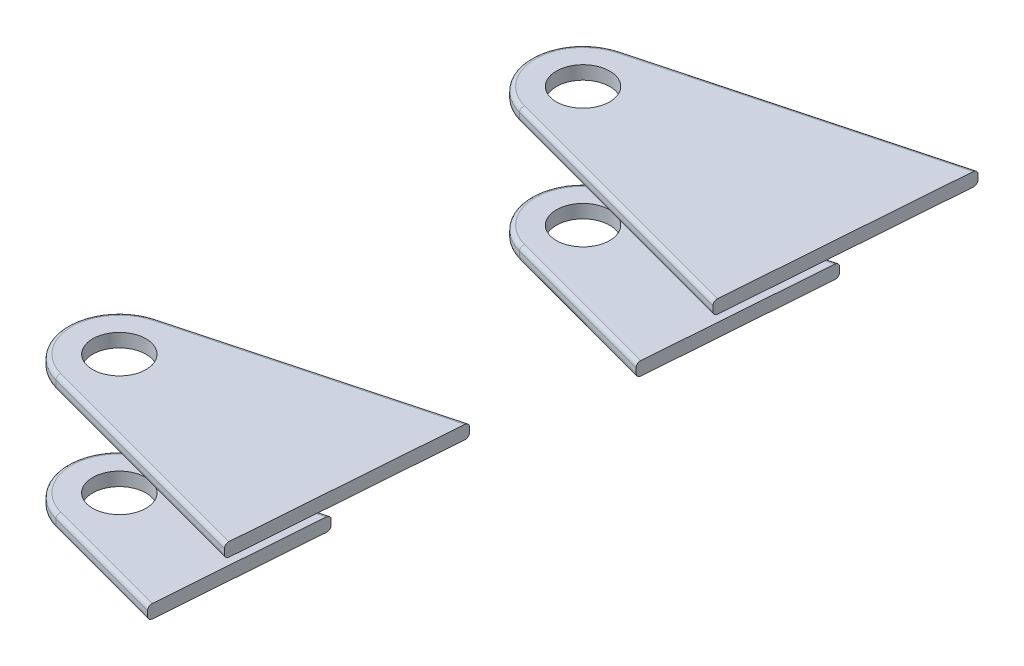
from build123d import *

# Parameters (mm, degrees)
SKETCH11_R                        = 12.7
SKETCH11_R_2                      = 10.7
STRUCTURAL_MEMBER1_DEPTH          = 323.944708568
SKETCH11_ON_SEGMENT_2_R           = 12.7
SKETCH11_ON_SEGMENT_2_R_2         = 10.7
STRUCTURAL_MEMBER1_2_DEPTH        = 323.944708568
EXTRUDEBEARINGRETAINERCYL_START   = -8.5
SKETCH13_R                        = 20.1
SKETCH13_R_2                      = 18.5
EXTRUDEBEARINGRETAINERCYL_DEPTH   = 17
EXTRUDEBRACKETBOTTOM_DEPTH        = 1
EXTRUDEBRACKETTOP_DEPTH           = 1
EXTRUDEBRACKETTOP_2_DEPTH         = 1
EXTRUDEBRACKETTOP_3_DEPTH         = 1
EXTRUDEPILLOWBLOCKTOCYL_START     = -72.5
EXTRUDEPILLOWBLOCKTOCYL_DEPTH     = 1.6
EXTRUDEPILLOWBLOCKTOCYL_START_2   = -59.1
EXTRUDEPILLOWBLOCKTOCYL_2_DEPTH   = 1.6
EXTRUDEPILLOWBLOCKTOCYL_START_3   = 57.5
EXTRUDEPILLOWBLOCKTOCYL_3_DEPTH   = 1.6
EXTRUDEPILLOWBLOCKTOCYL_START_4   = 70.9
EXTRUDEPILLOWBLOCKTOCYL_4_DEPTH   = 1.6
SKETCH28_W                        = 75.967346768
SKETCH28_H                        = 30.904
EXTRUDETRIMPILLOWBLOCKS_DEPTH     = 145
SKETCH29_R                        = 6
EXTRUDEPILLOWBLOCKBOSSES_DEPTH    = 30.904
FILLET6_START                     = 1
FILLET6_DEPTH                     = 29.904
FILLET6_2_DEPTH                   = 30.904
FILLET6_3_ANGLE                   = 105.281339
FILLET6_4_ANGLE                   = 105.281339
FILLET6_5_ANGLE                   = 105.281339
EXTRUDEPILLOWBLOCKTOPS_REACH      = 277.503
EXTRUDEPILLOWBLOCKTOPS_END_RADIUS = 20.1
SKETCH30_W                        = 15
SKETCH30_H                        = 3
FILLETPILLOWBLOCKTOPS_R           = 3
SKETCH19_R                        = 3.175
EXTRUDEBEARINGRETAINERHOLES_DEPTH = 380.637720529
EXTRUDEBRACKETFRONT_DEPTH         = 1.6
EXTRUDEBRACKETREAR_START          = -70
EXTRUDEBRACKETREAR_DEPTH          = 1.6
SKETCH25_R                        = 6.175
EXTRUDEMOUNTINGBOSSES_DEPTH       = 11.7
EXTRUDE2_DEPTH                    = 380.993173687
EXTRUDE2_DEPTH_BACK               = 380.993173687
SKETCH26_R                        = 3.175
SKETCH36_R                        = 3.175
EXTRUDE7_DEPTH                    = 1.6
EXTRUDE7_2_DEPTH                  = 1.6
SKETCH38_R                        = 3.175
EXTRUDE10_DEPTH                   = 1.6
EXTRUDE10_2_DEPTH                 = 1.6
FILLET25_R                        = 0.5
FILLET26_R                        = 0.5
FILLET27_R                        = 0.5
FILLET28_R                        = 0.5


with BuildPart() as part:
    # Sketch11 → Structural Member1 (new body)
    with BuildSketch(Plane(origin=(-155.9, 0, 323.047), x_dir=(-0.9972288216354868, 0, 0.07439541181752263), z_dir=(-0.07439541181752263, 0, -0.9972288216354868))):
        Circle(SKETCH11_R)
        Circle(SKETCH11_R_2, mode=Mode.SUBTRACT)
    extrude(amount=STRUCTURAL_MEMBER1_DEPTH)


with BuildPart() as body_2:
    # Sketch11 on segment 2 (carried to segment 2) → Structural Member1 2 (new body)
    with BuildSketch(Plane(origin=(180, 0, 0), x_dir=(0.997228822, 0, 0.074395412), z_dir=(-0.074395412, 0, 0.997228822))):
        Circle(SKETCH11_ON_SEGMENT_2_R)
        Circle(SKETCH11_ON_SEGMENT_2_R_2, mode=Mode.SUBTRACT)
    extrude(amount=STRUCTURAL_MEMBER1_2_DEPTH)


with BuildPart() as body_3:
    # Sketch13 → ExtrudeBearingRetainerCyl (new body)
    with BuildSketch(Plane(origin=(65, 0, 0), x_dir=(0, 0, -1), z_dir=(1, 0, 0)).offset(EXTRUDEBEARINGRETAINERCYL_START)):
        with Locations((-98, 27.904)):
            Circle(SKETCH13_R)
        with Locations((-98, 27.904)):
            Circle(SKETCH13_R_2, mode=Mode.SUBTRACT)
    extrude(amount=EXTRUDEBEARINGRETAINERCYL_DEPTH)


with BuildPart() as body_4:
    # MirrorBearingRetainerCyl: mirrored copy
    add(body_3.part.mirror(Plane(origin=(0, 0, 0), x_dir=(0, 0, 1), z_dir=(1, 0, 0))))



with BuildPart() as body_5:
    # Sketch15 → ExtrudeBracketBottom (new body)
    with BuildSketch(Plane(origin=(0, 0, 0), x_dir=(1, 0, 0), z_dir=(0, 1, 0))):
        with BuildLine():
            Line((-150, -63), (115, -63))
            ThreePointArc((115, -63), (122.071067812, -60.071067812), (125, -53))
            Line((125, -53), (125, -48))
            ThreePointArc((125, -48), (137.5, -35.5), (150, -48))
            Line((150, -48), (150, -63))
            Line((150, -63), (150, -133))
            Line((150, -133), (-150, -133))
            Line((-150, -133), (-150, -63))
        make_face()
        with BuildLine():
            Line((-130, -75), (130, -75))
            ThreePointArc((130, -75), (137.071067812, -77.928932188), (140, -85))
            Line((140, -85), (140, -111))
            ThreePointArc((140, -111), (137.071067812, -118.071067812), (130, -121))
            Line((130, -121), (-130, -121))
            ThreePointArc((-130, -121), (-137.071067812, -118.071067812), (-140, -111))
            Line((-140, -111), (-140, -85))
            ThreePointArc((-140, -85), (-137.071067812, -77.928932188), (-130, -75))
        make_face(mode=Mode.SUBTRACT)
    extrude(amount=EXTRUDEBRACKETBOTTOM_DEPTH)


with BuildPart() as body_6:
    # Sketch17 → ExtrudeBracketTop (new body)
    with BuildSketch(Plane(origin=(0, 12.7, 0), x_dir=(-1, 0, 0), z_dir=(0, 1, 0))):
        with BuildLine():
            Line((150, 63), (72.5, 63))
            Line((72.5, 63), (72.5, 82))
            Line((72.5, 82), (77.5, 82))
            ThreePointArc((77.5, 82), (80.328427125, 83.171572875), (81.5, 86))
            Line((81.5, 86), (81.5, 110))
            ThreePointArc((81.5, 110), (80.328427125, 112.828427125), (77.5, 114))
            Line((77.5, 114), (72.5, 114))
            Line((72.5, 114), (72.5, 133))
            Line((72.5, 133), (150, 133))
            Line((150, 133), (150, 63))
        make_face()
        with BuildLine():
            Line((104.221825407, 94.464466094), (97.535533906, 87.778174593))
            ThreePointArc((97.535533906, 87.778174593), (92.086582838, 86.694310836), (89, 91.313708499))
            Line((89, 91.313708499), (89, 104.686291501))
            ThreePointArc((89, 104.686291501), (92.086582838, 109.305689164), (97.535533906, 108.221825407))
            Line((97.535533906, 108.221825407), (104.221825407, 101.535533906))
            ThreePointArc((104.221825407, 101.535533906), (105.686291501, 98), (104.221825407, 94.464466094))
        make_face(mode=Mode.SUBTRACT)
        with BuildLine():
            Line((118.686291501, 121), (105.313708499, 121))
            ThreePointArc((105.313708499, 121), (100.694310836, 117.913417162), (101.778174593, 112.464466094))
            Line((101.778174593, 112.464466094), (108.464466094, 105.778174593))
            ThreePointArc((108.464466094, 105.778174593), (112, 104.313708499), (115.535533906, 105.778174593))
            Line((115.535533906, 105.778174593), (122.221825407, 112.464466094))
            ThreePointArc((122.221825407, 112.464466094), (123.305689164, 117.913417162), (118.686291501, 121))
        make_face(mode=Mode.SUBTRACT)
        with BuildLine():
            Line((108.464466094, 90.221825407), (101.778174593, 83.535533906))
            ThreePointArc((101.778174593, 83.535533906), (100.694310836, 78.086582838), (105.313708499, 75))
            Line((105.313708499, 75), (118.686291501, 75))
            ThreePointArc((118.686291501, 75), (123.305689164, 78.086582838), (122.221825407, 83.535533906))
            Line((122.221825407, 83.535533906), (115.535533906, 90.221825407))
            ThreePointArc((115.535533906, 90.221825407), (112, 91.686291501), (108.464466094, 90.221825407))
        make_face(mode=Mode.SUBTRACT)
        with BuildLine():
            Line((126.464466094, 108.221825407), (119.778174593, 101.535533906))
            ThreePointArc((119.778174593, 101.535533906), (118.313708499, 98), (119.778174593, 94.464466094))
            Line((119.778174593, 94.464466094), (126.464466094, 87.778174593))
            ThreePointArc((126.464466094, 87.778174593), (131.913417162, 86.694310836), (135, 91.313708499))
            Line((135, 91.313708499), (135, 104.686291501))
            ThreePointArc((135, 104.686291501), (131.913417162, 109.305689164), (126.464466094, 108.221825407))
        make_face(mode=Mode.SUBTRACT)
    extrude(amount=-EXTRUDEBRACKETTOP_DEPTH)


with BuildPart() as body_7:
    # Sketch17 → ExtrudeBracketTop 2 (new body)
    with BuildSketch(Plane(origin=(0, 12.7, 0), x_dir=(-1, 0, 0), z_dir=(0, 1, 0))):
        with BuildLine():
            Line((-150, 133), (-72.5, 133))
            Line((-72.5, 133), (-72.5, 114))
            Line((-72.5, 114), (-77.5, 114))
            ThreePointArc((-77.5, 114), (-80.328427125, 112.828427125), (-81.5, 110))
            Line((-81.5, 110), (-81.5, 86))
            ThreePointArc((-81.5, 86), (-80.328427125, 83.171572875), (-77.5, 82))
            Line((-77.5, 82), (-72.5, 82))
            Line((-72.5, 82), (-72.5, 63))
            Line((-72.5, 63), (-115, 63))
            ThreePointArc((-115, 63), (-122.071067812, 60.071067812), (-125, 53))
            Line((-125, 53), (-125, 48))
            ThreePointArc((-125, 48), (-137.5, 35.5), (-150, 48))
            Line((-150, 48), (-150, 51.104))
            Line((-150, 51.104), (-150, 133))
        make_face()
        with BuildLine():
            Line((-119.778174593, 94.464466094), (-126.464466094, 87.778174593))
            ThreePointArc((-126.464466094, 87.778174593), (-131.913417162, 86.694310836), (-135, 91.313708499))
            Line((-135, 91.313708499), (-135, 104.686291501))
            ThreePointArc((-135, 104.686291501), (-131.913417162, 109.305689164), (-126.464466094, 108.221825407))
            Line((-126.464466094, 108.221825407), (-119.778174593, 101.535533906))
            ThreePointArc((-119.778174593, 101.535533906), (-118.313708499, 98), (-119.778174593, 94.464466094))
        make_face(mode=Mode.SUBTRACT)
        with BuildLine():
            Line((-105.313708499, 75), (-118.686291501, 75))
            ThreePointArc((-118.686291501, 75), (-123.305689164, 78.086582838), (-122.221825407, 83.535533906))
            Line((-122.221825407, 83.535533906), (-115.535533906, 90.221825407))
            ThreePointArc((-115.535533906, 90.221825407), (-112, 91.686291501), (-108.464466094, 90.221825407))
            Line((-108.464466094, 90.221825407), (-101.778174593, 83.535533906))
            ThreePointArc((-101.778174593, 83.535533906), (-100.694310836, 78.086582838), (-105.313708499, 75))
        make_face(mode=Mode.SUBTRACT)
        with BuildLine():
            Line((-101.778174593, 112.464466094), (-108.464466094, 105.778174593))
            ThreePointArc((-108.464466094, 105.778174593), (-112, 104.313708499), (-115.535533906, 105.778174593))
            Line((-115.535533906, 105.778174593), (-122.221825407, 112.464466094))
            ThreePointArc((-122.221825407, 112.464466094), (-123.305689164, 117.913417162), (-118.686291501, 121))
            Line((-118.686291501, 121), (-105.313708499, 121))
            ThreePointArc((-105.313708499, 121), (-100.694310836, 117.913417162), (-101.778174593, 112.464466094))
        make_face(mode=Mode.SUBTRACT)
        with BuildLine():
            Line((-89, 91.313708499), (-89, 104.686291501))
            ThreePointArc((-89, 104.686291501), (-92.086582838, 109.305689164), (-97.535533906, 108.221825407))
            Line((-97.535533906, 108.221825407), (-104.221825407, 101.535533906))
            ThreePointArc((-104.221825407, 101.535533906), (-105.686291501, 98), (-104.221825407, 94.464466094))
            Line((-104.221825407, 94.464466094), (-97.535533906, 87.778174593))
            ThreePointArc((-97.535533906, 87.778174593), (-92.086582838, 86.694310836), (-89, 91.313708499))
        make_face(mode=Mode.SUBTRACT)
    extrude(amount=-EXTRUDEBRACKETTOP_2_DEPTH)


with BuildPart() as body_8:
    # Sketch17 → ExtrudeBracketTop 3 (new body)
    with BuildSketch(Plane(origin=(0, 12.7, 0), x_dir=(-1, 0, 0), z_dir=(0, 1, 0))):
        with BuildLine():
            Line((-52.5, 82), (-57.5, 82))
            Line((-57.5, 82), (-57.5, 63))
            Line((-57.5, 63), (57.5, 63))
            Line((57.5, 63), (57.5, 82))
            Line((57.5, 82), (52.5, 82))
            ThreePointArc((52.5, 82), (49.671572875, 83.171572875), (48.5, 86))
            Line((48.5, 86), (48.5, 110))
            ThreePointArc((48.5, 110), (49.671572875, 112.828427125), (52.5, 114))
            Line((52.5, 114), (57.5, 114))
            Line((57.5, 114), (57.5, 133))
            Line((57.5, 133), (-57.5, 133))
            Line((-57.5, 133), (-57.5, 114))
            Line((-57.5, 114), (-52.5, 114))
            ThreePointArc((-52.5, 114), (-49.671572875, 112.828427125), (-48.5, 110))
            Line((-48.5, 110), (-48.5, 86))
            ThreePointArc((-48.5, 86), (-49.671572875, 83.171572875), (-52.5, 82))
        make_face()
        with BuildLine():
            Line((-7.289545837, 95.422213636), (-16.210396731, 86.501362742))
            ThreePointArc((-16.210396731, 86.501362742), (-20.544773044, 85.639201688), (-23, 89.313708499))
            Line((-23, 89.313708499), (-23, 107.155410287))
            ThreePointArc((-23, 107.155410287), (-20.544773044, 110.829917097), (-16.210396731, 109.967756044))
            Line((-16.210396731, 109.967756044), (-7.289545837, 101.04690515))
            ThreePointArc((-7.289545837, 101.04690515), (-6.124634082, 98.234559393), (-7.289545837, 95.422213636))
        make_face(mode=Mode.SUBTRACT)
        with BuildLine():
            Line((9.155410287, 75), (-8.686291501, 75))
            ThreePointArc((-8.686291501, 75), (-12.360798312, 77.455226956), (-11.498637258, 81.789603269))
            Line((-11.498637258, 81.789603269), (-2.577786364, 90.710454163))
            ThreePointArc((-2.577786364, 90.710454163), (0.234559393, 91.875365918), (3.04690515, 90.710454163))
            Line((3.04690515, 90.710454163), (11.967756044, 81.789603269))
            ThreePointArc((11.967756044, 81.789603269), (12.829917097, 77.455226956), (9.155410287, 75))
        make_face(mode=Mode.SUBTRACT)
        with BuildLine():
            Line((11.498637258, 114.210396731), (2.577786364, 105.289545837))
            ThreePointArc((2.577786364, 105.289545837), (-0.234559393, 104.124634082), (-3.04690515, 105.289545837))
            Line((-3.04690515, 105.289545837), (-11.967756044, 114.210396731))
            ThreePointArc((-11.967756044, 114.210396731), (-12.829917097, 118.544773044), (-9.155410287, 121))
            Line((-9.155410287, 121), (8.686291501, 121))
            ThreePointArc((8.686291501, 121), (12.360798312, 118.544773044), (11.498637258, 114.210396731))
        make_face(mode=Mode.SUBTRACT)
        with BuildLine():
            Line((23, 88.844589713), (23, 106.686291501))
            ThreePointArc((23, 106.686291501), (20.544773044, 110.360798312), (16.210396731, 109.498637258))
            Line((16.210396731, 109.498637258), (7.289545837, 100.577786364))
            ThreePointArc((7.289545837, 100.577786364), (6.124634082, 97.765440607), (7.289545837, 94.95309485))
            Line((7.289545837, 94.95309485), (16.210396731, 86.032243956))
            ThreePointArc((16.210396731, 86.032243956), (20.544773044, 85.170082903), (23, 88.844589713))
        make_face(mode=Mode.SUBTRACT)
    extrude(amount=-EXTRUDEBRACKETTOP_3_DEPTH)


with BuildPart() as body_4_1:
    add(body_4.part)

    add(body_5.part)  # ExtrudePillowBlockToCyl merges body 5

    add(body_6.part)  # ExtrudePillowBlockToCyl merges body 6
    # ExtrudePillowBlockToCyl: read off the stored shape, not the designer's step
    # ExtrudePillowBlockToCyl outline → ExtrudePillowBlockToCyl (add)
    with BuildSketch(Plane.YZ.offset(EXTRUDEPILLOWBLOCKTOCYL_START)):
        with BuildLine():
            Line((0, 133), (0, -12.967346768))
            Line((0, -12.967346768), (30.904, -12.967346768))
            Line((30.904, -12.967346768), (30.904, 78.12514151))
            ThreePointArc((30.904, 78.12514151), (7.804, 98), (30.904, 117.87485849))
            Line((30.904, 117.87485849), (30.904, 133))
            Line((30.904, 133), (1, 133))
            Line((1, 133), (0, 133))
        make_face()
    extrude(amount=EXTRUDEPILLOWBLOCKTOCYL_DEPTH)


    add(body_8.part)  # ExtrudePillowBlockToCyl 2 merges body 8
    # ExtrudePillowBlockToCyl 2 outline → ExtrudePillowBlockToCyl 2 (add)
    with BuildSketch(Plane.YZ.offset(EXTRUDEPILLOWBLOCKTOCYL_START_2)):
        with BuildLine():
            Line((0, 133), (0, -12.967346768))
            Line((0, -12.967346768), (30.904, -12.967346768))
            Line((30.904, -12.967346768), (30.904, 78.12514151))
            ThreePointArc((30.904, 78.12514151), (7.804, 98), (30.904, 117.87485849))
            Line((30.904, 117.87485849), (30.904, 133))
            Line((30.904, 133), (1, 133))
            Line((1, 133), (0, 133))
        make_face()
    extrude(amount=EXTRUDEPILLOWBLOCKTOCYL_2_DEPTH)


with BuildPart() as body_3_1:
    add(body_3.part)

    add(body_4_1.part)  # ExtrudePillowBlockToCyl 3 merges body 4
    # ExtrudePillowBlockToCyl 3 outline → ExtrudePillowBlockToCyl 3 (add)
    with BuildSketch(Plane.YZ.offset(EXTRUDEPILLOWBLOCKTOCYL_START_3)):
        with BuildLine():
            Line((0, 133), (0, -12.967346768))
            Line((0, -12.967346768), (30.904, -12.967346768))
            Line((30.904, -12.967346768), (30.904, 78.12514151))
            ThreePointArc((30.904, 78.12514151), (7.804, 98), (30.904, 117.87485849))
            Line((30.904, 117.87485849), (30.904, 133))
            Line((30.904, 133), (1, 133))
            Line((1, 133), (0, 133))
        make_face()
    extrude(amount=EXTRUDEPILLOWBLOCKTOCYL_3_DEPTH)

    add(body_7.part)  # ExtrudePillowBlockToCyl 4 merges body 7
    # ExtrudePillowBlockToCyl 4 outline → ExtrudePillowBlockToCyl 4 (add)
    with BuildSketch(Plane.YZ.offset(EXTRUDEPILLOWBLOCKTOCYL_START_4)):
        with BuildLine():
            Line((0, 133), (0, -12.967346768))
            Line((0, -12.967346768), (30.904, -12.967346768))
            Line((30.904, -12.967346768), (30.904, 78.12514151))
            ThreePointArc((30.904, 78.12514151), (7.804, 98), (30.904, 117.87485849))
            Line((30.904, 117.87485849), (30.904, 133))
            Line((30.904, 133), (1, 133))
            Line((1, 133), (0, 133))
        make_face()
    extrude(amount=EXTRUDEPILLOWBLOCKTOCYL_4_DEPTH)

    # Sketch28 → ExtrudeTrimPillowBlocks (cut)
    with BuildSketch(Plane(origin=(72.5, 0, 0), x_dir=(0, 0, -1), z_dir=(1, 0, 0))):
        with Locations((-25.016326616, 15.452)):
            Rectangle(SKETCH28_W, SKETCH28_H)
    extrude(amount=-EXTRUDETRIMPILLOWBLOCKS_DEPTH, mode=Mode.SUBTRACT)

    # Sketch29 → ExtrudePillowBlockBosses (add)
    with BuildSketch(Plane(origin=(0, 0, 0), x_dir=(1, 0, 0), z_dir=(0, 1, 0))):
        with Locations((65, -125.5)):
            Circle(SKETCH29_R)
        with Locations((-65, -125.5)):
            Circle(SKETCH29_R)
        with Locations((-65, -70.5)):
            Circle(SKETCH29_R)
        with Locations((65, -70.5)):
            Circle(SKETCH29_R)
    extrude(amount=EXTRUDEPILLOWBLOCKBOSSES_DEPTH)

    # Fillet6: read off the stored shape, not the designer's step
    # Fillet6 outline → Fillet6 (add)
    with BuildSketch(Plane(origin=(0, 0, 0), x_dir=(1, 0, 0), z_dir=(0, 1, 0)).offset(FILLET6_START)):
        with BuildLine():
            Line((-59.1, -69.409128789), (-59.1, -65.5010001))
            ThreePointArc((-59.1, -65.5010001), (-59.712701665, -66.422954546), (-60.8, -66.215142943))
            ThreePointArc((-60.8, -66.215142943), (-59.703502441, -67.68093746), (-59.1, -69.409128789))
        make_face()
        with BuildLine():
            ThreePointArc((-70.9, -69.409128789), (-70.296497559, -67.68093746), (-69.2, -66.215142943))
            ThreePointArc((-69.2, -66.215142943), (-70.287298335, -66.422954546), (-70.9, -65.5010001))
            Line((-70.9, -65.5010001), (-70.9, -69.409128789))
        make_face()
        with BuildLine():
            Line((70.9, -69.409128789), (70.9, -65.5010001))
            ThreePointArc((70.9, -65.5010001), (70.287298335, -66.422954546), (69.2, -66.215142943))
            ThreePointArc((69.2, -66.215142943), (70.296497559, -67.68093746), (70.9, -69.409128789))
        make_face()
        with BuildLine():
            ThreePointArc((59.1, -69.409128789), (59.703502441, -67.68093746), (60.8, -66.215142943))
            ThreePointArc((60.8, -66.215142943), (59.712701665, -66.422954546), (59.1, -65.5010001))
            Line((59.1, -65.5010001), (59.1, -69.409128789))
        make_face()
        with BuildLine():
            Line((59.1, -126.590871211), (59.1, -130.4989999))
            ThreePointArc((59.1, -130.4989999), (59.712701665, -129.577045454), (60.8, -129.784857057))
            ThreePointArc((60.8, -129.784857057), (59.703502441, -128.31906254), (59.1, -126.590871211))
        make_face()
        with BuildLine():
            ThreePointArc((70.9, -126.590871211), (70.296497559, -128.31906254), (69.2, -129.784857057))
            ThreePointArc((69.2, -129.784857057), (70.287298335, -129.577045454), (70.9, -130.4989999))
            Line((70.9, -130.4989999), (70.9, -126.590871211))
        make_face()
        with BuildLine():
            ThreePointArc((-59.1, -126.590871211), (-59.703502441, -128.31906254), (-60.8, -129.784857057))
            ThreePointArc((-60.8, -129.784857057), (-59.712701665, -129.577045454), (-59.1, -130.4989999))
            Line((-59.1, -130.4989999), (-59.1, -126.590871211))
        make_face()
        with BuildLine():
            ThreePointArc((-70.9, -130.4989999), (-70.287298335, -129.577045454), (-69.2, -129.784857057))
            ThreePointArc((-69.2, -129.784857057), (-70.296497559, -128.31906254), (-70.9, -126.590871211))
            Line((-70.9, -126.590871211), (-70.9, -130.4989999))
        make_face()
    extrude(amount=FILLET6_DEPTH)

    # Fillet6 2 outline → Fillet6 2 (add)
    with BuildSketch(Plane(origin=(0, 0, 0), x_dir=(1, 0, 0), z_dir=(0, 1, 0))):
        with BuildLine():
            ThreePointArc((70.9, -120.5010001), (70.287298335, -121.422954546), (69.2, -121.215142943))
            ThreePointArc((69.2, -121.215142943), (70.296497559, -122.68093746), (70.9, -124.409128789))
            Line((70.9, -124.409128789), (70.9, -120.5010001))
        make_face()
        with BuildLine():
            Line((70.9, -75.4989999), (70.9, -71.590871211))
            ThreePointArc((70.9, -71.590871211), (70.296497559, -73.31906254), (69.2, -74.784857057))
            ThreePointArc((69.2, -74.784857057), (70.287298335, -74.577045454), (70.9, -75.4989999))
        make_face()
        with BuildLine():
            ThreePointArc((59.1, -124.409128789), (59.703502441, -122.68093746), (60.8, -121.215142943))
            ThreePointArc((60.8, -121.215142943), (59.712701665, -121.422954546), (59.1, -120.5010001))
            Line((59.1, -120.5010001), (59.1, -124.409128789))
        make_face()
        with BuildLine():
            ThreePointArc((60.8, -74.784857057), (59.703502441, -73.31906254), (59.1, -71.590871211))
            Line((59.1, -71.590871211), (59.1, -75.4989999))
            ThreePointArc((59.1, -75.4989999), (59.712701665, -74.577045454), (60.8, -74.784857057))
        make_face()
        with BuildLine():
            ThreePointArc((-70.9, -75.4989999), (-70.287298335, -74.577045454), (-69.2, -74.784857057))
            ThreePointArc((-69.2, -74.784857057), (-70.296497559, -73.31906254), (-70.9, -71.590871211))
            Line((-70.9, -71.590871211), (-70.9, -75.4989999))
        make_face()
        with BuildLine():
            Line((-70.9, -120.5010001), (-70.9, -124.409128789))
            ThreePointArc((-70.9, -124.409128789), (-70.296497559, -122.68093746), (-69.2, -121.215142943))
            ThreePointArc((-69.2, -121.215142943), (-70.287298335, -121.422954546), (-70.9, -120.5010001))
        make_face()
        with BuildLine():
            ThreePointArc((-59.1, -71.590871211), (-59.703502441, -73.31906254), (-60.8, -74.784857057))
            ThreePointArc((-60.8, -74.784857057), (-59.712701665, -74.577045454), (-59.1, -75.4989999))
            Line((-59.1, -75.4989999), (-59.1, -71.590871211))
        make_face()
        with BuildLine():
            ThreePointArc((-60.8, -121.215142943), (-59.703502441, -122.68093746), (-59.1, -124.409128789))
            Line((-59.1, -124.409128789), (-59.1, -120.5010001))
            ThreePointArc((-59.1, -120.5010001), (-59.712701665, -121.422954546), (-60.8, -121.215142943))
        make_face()
    extrude(amount=FILLET6_2_DEPTH)

    # Fillet6 3 outline → Fillet6 3 (revolve)
    with BuildSketch(Plane(origin=(65, 0, 70.5), x_dir=(0.7948455434118173, 0, -0.6068118012352535), z_dir=(0.6068118012352535, 0, 0.7948455434118173))):
        with BuildLine():
            ThreePointArc((7, 1), (6.292893219, 1.292893219), (6, 2))
            Line((6, 2), (6, 1))
            Line((6, 1), (7, 1))
        make_face()
    revolve(axis=Axis((65, 0, 70.5), (0, 1, 0)), revolution_arc=FILLET6_3_ANGLE)

    # Fillet6 4 outline → Fillet6 4 (revolve)
    with BuildSketch(Plane(origin=(65, 0, 125.5), x_dir=(-0.7948455434118179, 0, 0.6068118012352527), z_dir=(-0.6068118012352527, 0, -0.7948455434118179))):
        with BuildLine():
            ThreePointArc((7, 1), (6.292893219, 1.292893219), (6, 2))
            Line((6, 2), (6, 1))
            Line((6, 1), (7, 1))
        make_face()
    revolve(axis=Axis((65, 0, 125.5), (0, 1, 0)), revolution_arc=FILLET6_4_ANGLE)

    # Fillet6 5 outline → Fillet6 5 (revolve)
    with BuildSketch(Plane(origin=(-65, 0, 125.5), x_dir=(-0.794845543411815, 0, 0.6068118012352566), z_dir=(-0.6068118012352566, 0, -0.794845543411815))):
        with BuildLine():
            ThreePointArc((7, 1), (6.292893219, 1.292893219), (6, 2))
            Line((6, 2), (6, 1))
            Line((6, 1), (7, 1))
        make_face()
    revolve(axis=Axis((-65, 0, 125.5), (0, 1, 0)), revolution_arc=FILLET6_5_ANGLE)

    # ExtrudePillowBlockTops: up to this cylinder (the profile starts outside it)
    extrudepillowblocktops_end = Plane(origin=(0, 27.904, 98), z_dir=(-1, 0, 0)) * Cylinder(EXTRUDEPILLOWBLOCKTOPS_END_RADIUS, 726.206, mode=Mode.PRIVATE)
    # Sketch30 → ExtrudePillowBlockTops (add, up to the surface)
    with BuildSketch(Plane.XY.offset(133), mode=Mode.PRIVATE) as extrudepillowblocktops_sk1:
        with Locations((-65, 30.904)):
            Rectangle(SKETCH30_W, SKETCH30_H)
    extrudepillowblocktops_tool1 = extrude(extrudepillowblocktops_sk1.sketch, amount=-EXTRUDEPILLOWBLOCKTOPS_REACH, mode=Mode.PRIVATE) - extrudepillowblocktops_end
    # Sketch30 → ExtrudePillowBlockTops (add, up to the surface)
    with BuildSketch(Plane.XY.offset(133), mode=Mode.PRIVATE) as extrudepillowblocktops_sk2:
        with Locations((65, 30.904)):
            Rectangle(SKETCH30_W, SKETCH30_H)
    extrudepillowblocktops_tool2 = extrude(extrudepillowblocktops_sk2.sketch, amount=-EXTRUDEPILLOWBLOCKTOPS_REACH, mode=Mode.PRIVATE) - extrudepillowblocktops_end
    extrudepillowblocktops = extrudepillowblocktops_tool1.solids().sort_by_distance((-65, 30.904, 133))[0] + extrudepillowblocktops_tool2.solids().sort_by_distance((65, 30.904, 133))[0]
    add(extrudepillowblocktops)

    # MirrorPillowBlockTops: ExtrudePillowBlockTops across plane
    add(extrudepillowblocktops.mirror(Plane.XY.offset(98)))

    # FilletPillowBlockTops
    filletpillowblocktops_edges = [body_3_1.edges().sort_by_distance(p)[0] for p in [
        (-65, 32.404, 117.589793261),
        (65, 32.404, 117.589793261),
        (-65, 32.404, 78.410206739),
        (65, 32.404, 78.410206739),
    ]]
    fillet(filletpillowblocktops_edges, radius=FILLETPILLOWBLOCKTOPS_R)

    # Sketch19 → ExtrudeBearingRetainerHoles (cut, through all)
    with BuildSketch(Plane(origin=(0, 32.404, 0), x_dir=(1, 0, 0), z_dir=(0, 1, 0))):
        with Locations(Location((65, -113.604, 0), (0, 0, 270))):
            Circle(SKETCH19_R)
        with Locations(Location((-65, -113.604, 0), (0, 0, 270))):
            Circle(SKETCH19_R)
        with Locations(Location((-65, -82.396, 0), (0, 0, 270))):
            Circle(SKETCH19_R)
        with Locations(Location((65, -82.396, 0), (0, 0, 270))):
            Circle(SKETCH19_R)
    extrude(amount=-EXTRUDEBEARINGRETAINERHOLES_DEPTH, mode=Mode.SUBTRACT)

    # Sketch20 → ExtrudeBracketFront (add)
    with BuildSketch(Plane.XY.offset(133)):
        Polygon((-98.5, 12.7), (-73.5, 27.904), (-53.5, 27.904), (-28.5, 12.7), (28.5, 12.7), (53.5, 27.904), (73.5, 27.904), (98.5, 12.7), (150, 12.7), (150, 0), (145, 0), (-145, 0), (-150, 0), (-150, 12.7), align=None)
    extrude(amount=EXTRUDEBRACKETFRONT_DEPTH)

    # Sketch20<3> → ExtrudeBracketRear (add)
    with BuildSketch(Plane.XY.offset(133).offset(EXTRUDEBRACKETREAR_START)):
        Polygon((-98.5, 12.7), (-73.5, 27.904), (-53.5, 27.904), (-28.5, 12.7), (28.5, 12.7), (53.5, 27.904), (73.5, 27.904), (98.5, 12.7), (150, 12.7), (150, 0), (145, 0), (-145, 0), (-150, 0), (-150, 12.7), align=None)
    extrude(amount=-EXTRUDEBRACKETREAR_DEPTH)

    # Sketch25 → ExtrudeMountingBosses (add)
    with BuildSketch(Plane(origin=(0, 0, 0), x_dir=(1, 0, 0), z_dir=(0, 1, 0))):
        with Locations(Location((-143.825, -70.4, 0), (0, 0, 180))):
            Circle(SKETCH25_R)
        with Locations(Location((-143.825, -125.6, 0), (0, 0, 180))):
            Circle(SKETCH25_R)
        with Locations((143.825, -70.4)):
            Circle(SKETCH25_R)
        with Locations((143.825, -125.6)):
            Circle(SKETCH25_R)
    extrude(amount=EXTRUDEMOUNTINGBOSSES_DEPTH)

    # Sketch26 → Extrude2 (cut, two sides: drawn at the far end of the back side and taken through both)
    with BuildSketch(Plane(origin=(0, 0, 0), x_dir=(1, 0, 0), z_dir=(0, 1, 0)).offset(-EXTRUDE2_DEPTH_BACK)):
        with Locations(Location((-143.825, -70.4, 0), (0, 0, 270))):
            Circle(SKETCH26_R)
        with Locations(Location((-143.825, -125.6, 0), (0, 0, 270))):
            Circle(SKETCH26_R)
        with Locations(Location((143.825, -70.4, 0), (0, 0, 270))):
            Circle(SKETCH26_R)
        with Locations(Location((143.825, -125.6, 0), (0, 0, 270))):
            Circle(SKETCH26_R)
    extrude(amount=EXTRUDE2_DEPTH + EXTRUDE2_DEPTH_BACK, mode=Mode.SUBTRACT)


with BuildPart() as body_4_2:
    # Sketch36 → Extrude7 (new body)
    with BuildSketch(Plane(origin=(0, 0, 0), x_dir=(1, 0, 0), z_dir=(0, 1, 0))):
        with BuildLine():
            Line((162.870344453, -58.90398492), (142.226792396, -64.435408023))
            ThreePointArc((142.226792396, -64.435408023), (137.65, -70.4), (142.226792396, -76.364591977))
            Line((142.226792396, -76.364591977), (161.188704901, -81.44542112))
            Line((161.188704901, -81.44542112), (162.870344453, -58.90398492))
        make_face()
        with Locations(Location((143.825, -70.4, 0), (0, 0, 270))):
            Circle(SKETCH36_R, mode=Mode.SUBTRACT)
    extrude(amount=-EXTRUDE7_DEPTH)

    # Fillet27
    fillet27_edges = [body_4_2.edges().sort_by_distance(p)[0] for p in [
        (137.65, -1.6, 70.4),
        (151.707748649, -1.6, 78.905006549),
        (151.707748649, 0, 78.905006549),
        (137.65, 0, 70.4),
        (152.548568425, 0, 61.669696471),
        (152.548568425, -1.6, 61.669696471),
    ]]
    fillet(fillet27_edges, radius=FILLET27_R)


with BuildPart() as body_5_2:
    # Sketch36 → Extrude7 2 (new body)
    with BuildSketch(Plane(origin=(0, 0, 0), x_dir=(1, 0, 0), z_dir=(0, 1, 0))):
        with BuildLine():
            Line((157.15137098, -135.563620756), (158.668308955, -115.229916938))
            Line((158.668308955, -115.229916938), (142.226792396, -119.635408023))
            ThreePointArc((142.226792396, -119.635408023), (137.65, -125.6), (142.226792396, -131.564591977))
            Line((142.226792396, -131.564591977), (157.15137098, -135.563620756))
        make_face()
        with Locations(Location((143.825, -125.6, 0), (0, 0, 270))):
            Circle(SKETCH36_R, mode=Mode.SUBTRACT)
    extrude(amount=-EXTRUDE7_2_DEPTH)

    # Fillet28
    fillet28_edges = [body_5_2.edges().sort_by_distance(p)[0] for p in [
        (150.447550676, -1.6, 117.432662481),
        (137.65, -1.6, 125.6),
        (150.447550676, 0, 117.432662481),
        (149.689081688, 0, 133.564106367),
        (137.65, 0, 125.6),
        (149.689081688, -1.6, 133.564106367),
    ]]
    fillet(fillet28_edges, radius=FILLET28_R)


with BuildPart() as body_6_2:
    # Sketch38 → Extrude10 (new body)
    with BuildSketch(Plane(origin=(0, 12.7, 0), x_dir=(-1, 0, 0), z_dir=(0, 1, 0))):
        with BuildLine():
            Line((-162.870344453, 58.90398492), (-175.865402029, 55.421969737))
            Line((-175.865402029, 55.421969737), (-173.674412549, 84.790956401))
            Line((-173.674412549, 84.790956401), (-161.188704901, 81.44542112))
            Line((-161.188704901, 81.44542112), (-142.226792396, 76.364591977))
            ThreePointArc((-142.226792396, 76.364591977), (-137.65, 70.4), (-142.226792396, 64.435408023))
            Line((-142.226792396, 64.435408023), (-162.870344453, 58.90398492))
        make_face()
        with Locations(Location((-143.825, 70.4, 0), (0, 0, 90))):
            Circle(SKETCH38_R, mode=Mode.SUBTRACT)
    extrude(amount=EXTRUDE10_DEPTH)

    # Fillet26
    fillet26_edges = [body_6_2.edges().sort_by_distance(p)[0] for p in [
        (159.046097213, 14.3, 59.92868888),
        (137.65, 14.3, 70.4),
        (159.046097213, 12.7, 59.92868888),
        (157.950602473, 14.3, 80.577774189),
        (157.950602473, 12.7, 80.577774189),
        (137.65, 12.7, 70.4),
    ]]
    fillet(fillet26_edges, radius=FILLET26_R)


with BuildPart() as body_7_2:
    # Sketch38 → Extrude10 2 (new body)
    with BuildSketch(Plane(origin=(0, 12.7, 0), x_dir=(-1, 0, 0), z_dir=(0, 1, 0))):
        with BuildLine():
            Line((-158.668308955, 115.229916938), (-171.663366531, 111.747901755))
            Line((-171.663366531, 111.747901755), (-169.637078628, 138.909156037))
            Line((-169.637078628, 138.909156037), (-157.15137098, 135.563620756))
            Line((-157.15137098, 135.563620756), (-142.226792396, 131.564591977))
            ThreePointArc((-142.226792396, 131.564591977), (-137.65, 125.6), (-142.226792396, 119.635408023))
            Line((-142.226792396, 119.635408023), (-158.668308955, 115.229916938))
        make_face()
        with Locations(Location((-143.825, 125.6, 0), (0, 0, 90))):
            Circle(SKETCH38_R, mode=Mode.SUBTRACT)
    extrude(amount=EXTRUDE10_2_DEPTH)

    # Fillet25
    fillet25_edges = [body_7_2.edges().sort_by_distance(p)[0] for p in [
        (155.931935512, 14.3, 135.236874007),
        (156.945079464, 14.3, 115.691654889),
        (156.945079464, 12.7, 115.691654889),
        (155.931935512, 12.7, 135.236874007),
        (137.65, 14.3, 125.6),
        (137.65, 12.7, 125.6),
    ]]
    fillet(fillet25_edges, radius=FILLET25_R)


solid = Compound([body_4_2.part, body_5_2.part, body_6_2.part, body_7_2.part])
